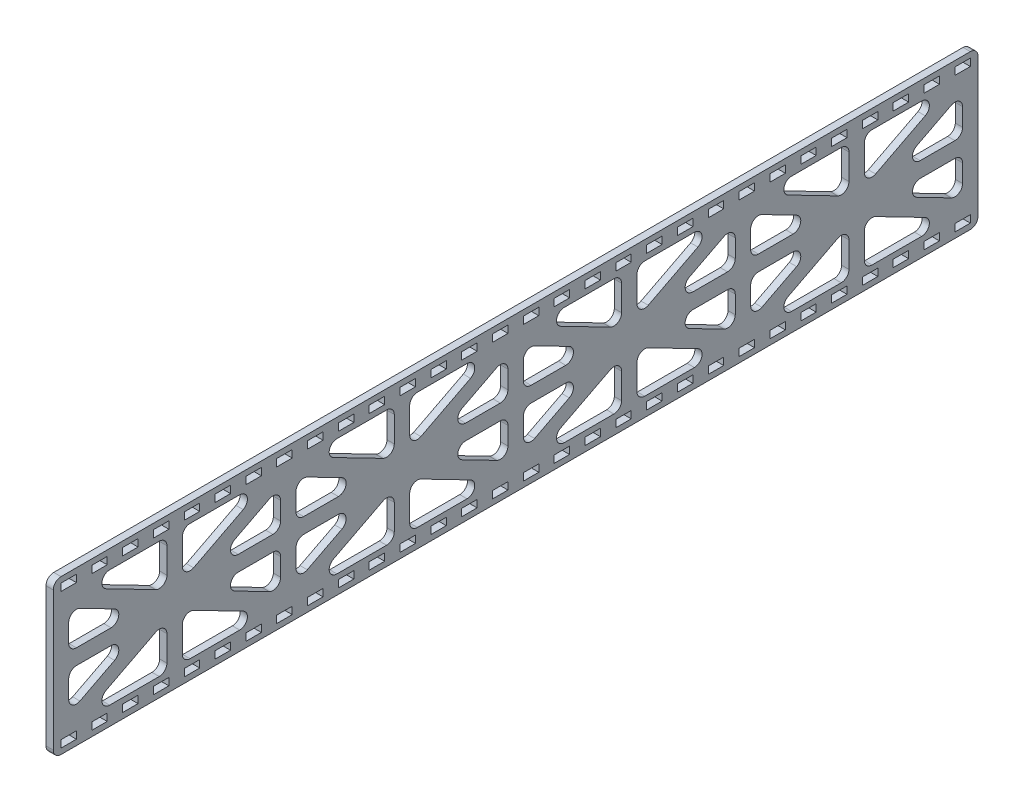
from build123d import *

# Parameters (mm, degrees)
SKETCH1_W          = 381
SKETCH1_H          = 63.5
OUTER_CUT_DEPTH    = 1.4986
CUT_EXTRUDE1_DEPTH = 194.150966106
FILLET1_R          = 3.175
SKETCH2_W          = 6.35
SKETCH2_H          = 3
SLOT_DEPTH         = 194.150966106
SLOTS_COUNT        = 16
SLOTS_PITCH        = 12.7
SLOTS_COUNT_DIR2   = 16
SLOTS_PITCH_DIR2   = 12.7


# Read off the part's stored shape, not the designer's step: Mirror1
with BuildPart() as part:
    # Sketch1 → Outer Cut (new, symmetric)
    with BuildSketch(Plane(origin=(0, 0, 0), x_dir=(0, 0, -1), z_dir=(1, 0, 0))):
        Rectangle(SKETCH1_W, SKETCH1_H)
    extrude(amount=OUTER_CUT_DEPTH, both=True)

    # Sketch3 → Cut-Extrude1 (cut, through all)
    with BuildSketch(Plane(origin=(1.4986, 0, 0), x_dir=(0, 0, -1), z_dir=(1, 0, 0))):
        Polygon((-184.15, 18.922387635), (-184.15, 3.175), (-153.587635839, 3.175), align=None)
        Polygon((-153.587635839, -3.175), (-184.15, -3.175), (-184.15, -18.922387635), align=None)
        Polygon((-143.66875, -5.207612365), (-180.39312074, -24.13), (-143.66875, -24.13), align=None)
        Polygon((-143.66875, 24.13), (-180.39312074, 24.13), (-143.66875, 5.207612365), align=None)
        Polygon((-100.59437926, 24.13), (-137.31875, 24.13), (-137.31875, 5.207612365), align=None)
        Polygon((-96.8375, 18.922387635), (-127.399864161, 3.175), (-96.8375, 3.175), align=None)
        Polygon((-127.399864161, -3.175), (-96.8375, -18.922387635), (-96.8375, -3.175), align=None)
        Polygon((-137.31875, -5.207612365), (-137.31875, -24.13), (-100.59437926, -24.13), align=None)
        Polygon((-50.00625, -5.207612365), (-86.73062074, -24.13), (-50.00625, -24.13), align=None)
        Polygon((-90.4875, -3.175), (-90.4875, -18.922387635), (-59.925135839, -3.175), align=None)
        Polygon((-90.4875, 18.922387635), (-90.4875, 3.175), (-59.925135839, 3.175), align=None)
        Polygon((-50.00625, 24.13), (-86.73062074, 24.13), (-50.00625, 5.207612365), align=None)
        Polygon((-6.93187926, 24.13), (-43.65625, 24.13), (-43.65625, 5.207612365), align=None)
        Polygon((-3.175, 18.922387635), (-33.737364161, 3.175), (-3.175, 3.175), align=None)
        Polygon((-33.737364161, -3.175), (-3.175, -18.922387635), (-3.175, -3.175), align=None)
        Polygon((-43.65625, -5.207612365), (-43.65625, -24.13), (-6.93187926, -24.13), align=None)
        Polygon((6.93187926, -24.13), (43.65625, -24.13), (43.65625, -5.207612365), align=None)
        Polygon((3.175, -3.175), (3.175, -18.922387635), (33.737364161, -3.175), align=None)
        Polygon((3.175, 18.922387635), (3.175, 3.175), (33.737364161, 3.175), align=None)
        Polygon((43.65625, 5.207612365), (43.65625, 24.13), (6.93187926, 24.13), align=None)
        Polygon((100.59437926, -24.13), (137.31875, -24.13), (137.31875, -5.207612365), align=None)
        Polygon((96.8375, -3.175), (96.8375, -18.922387635), (127.399864161, -3.175), align=None)
        Polygon((96.8375, 3.175), (127.399864161, 3.175), (96.8375, 18.922387635), align=None)
        Polygon((137.31875, 5.207612365), (137.31875, 24.13), (100.59437926, 24.13), align=None)
        Polygon((143.66875, 5.207612365), (180.39312074, 24.13), (143.66875, 24.13), align=None)
        Polygon((153.587635839, 3.175), (184.15, 3.175), (184.15, 18.922387635), align=None)
        Polygon((153.587635839, -3.175), (184.15, -18.922387635), (184.15, -3.175), align=None)
        Polygon((143.66875, -24.13), (180.39312074, -24.13), (143.66875, -5.207612365), align=None)
        Polygon((50.00625, -24.13), (86.73062074, -24.13), (50.00625, -5.207612365), align=None)
        Polygon((59.925135839, -3.175), (90.4875, -18.922387635), (90.4875, -3.175), align=None)
        Polygon((59.925135839, 3.175), (90.4875, 3.175), (90.4875, 18.922387635), align=None)
        Polygon((50.00625, 5.207612365), (86.73062074, 24.13), (50.00625, 24.13), align=None)
    extrude(amount=-CUT_EXTRUDE1_DEPTH, mode=Mode.SUBTRACT)

    # Fillet1
    fillet1_edges = [part.edges().sort_by_distance(p)[0] for p in [
        (0, 5.207612365, 43.65625),
        (0, 24.13, 43.65625),
        (0, 24.13, 6.93187926),
        (0, 24.13, 86.73062074),
        (0, 24.13, 50.00625),
        (0, 5.207612365, 50.00625),
        (0, 3.175, 90.4875),
        (0, 18.922387635, 90.4875),
        (0, 3.175, 59.925135839),
        (0, -18.922387635, 90.4875),
        (0, -3.175, 90.4875),
        (0, -3.175, 59.925135839),
        (0, -5.207612365, -43.65625),
        (0, -24.13, -43.65625),
        (0, -24.13, -6.93187926),
        (0, -5.207612365, 43.65625),
        (0, -24.13, 6.93187926),
        (0, -24.13, 43.65625),
        (0, -3.175, 33.737364161),
        (0, -3.175, 3.175),
        (0, -18.922387635, 3.175),
        (0, 3.175, 33.737364161),
        (0, 18.922387635, 3.175),
        (0, 3.175, 3.175),
        (0, -24.13, 180.39312074),
        (0, -5.207612365, 143.66875),
        (0, -24.13, 143.66875),
        (0, -18.922387635, 184.15),
        (0, -3.175, 184.15),
        (0, -3.175, 153.587635839),
        (0, 24.13, 180.39312074),
        (0, 24.13, 143.66875),
        (0, 5.207612365, 143.66875),
        (0, 5.207612365, 137.31875),
        (0, 24.13, 137.31875),
        (0, 24.13, 100.59437926),
        (0, -5.207612365, 50.00625),
        (0, -24.13, 50.00625),
        (0, -24.13, 86.73062074),
        (0, -5.207612365, 137.31875),
        (0, -24.13, 100.59437926),
        (0, -24.13, 137.31875),
        (0, -18.922387635, 96.8375),
        (0, -3.175, 127.399864161),
        (0, -3.175, 96.8375),
        (0, 3.175, 96.8375),
        (0, 3.175, 127.399864161),
        (0, 18.922387635, 96.8375),
        (0, -5.207612365, -50.00625),
        (0, -24.13, -86.73062074),
        (0, -24.13, -50.00625),
        (0, -5.207612365, -143.66875),
        (0, -24.13, -180.39312074),
        (0, -24.13, -143.66875),
        (0, -3.175, -153.587635839),
        (0, -3.175, -184.15),
        (0, -18.922387635, -184.15),
        (0, 3.175, -153.587635839),
        (0, 18.922387635, -184.15),
        (0, 3.175, -184.15),
        (0, 5.207612365, -50.00625),
        (0, 24.13, -50.00625),
        (0, 24.13, -86.73062074),
        (0, 3.175, -59.925135839),
        (0, 18.922387635, -90.4875),
        (0, 3.175, -90.4875),
        (0, -3.175, -59.925135839),
        (0, -3.175, -90.4875),
        (0, -18.922387635, -90.4875),
        (0, -5.207612365, -137.31875),
        (0, -24.13, -137.31875),
        (0, -24.13, -100.59437926),
        (0, 24.13, -6.93187926),
        (0, 24.13, -43.65625),
        (0, 5.207612365, -43.65625),
        (0, 18.922387635, -3.175),
        (0, 3.175, -33.737364161),
        (0, 3.175, -3.175),
        (0, -18.922387635, -3.175),
        (0, -3.175, -3.175),
        (0, -3.175, -33.737364161),
        (0, 24.13, -143.66875),
        (0, 24.13, -180.39312074),
        (0, 5.207612365, -143.66875),
        (0, 24.13, -100.59437926),
        (0, 24.13, -137.31875),
        (0, 5.207612365, -137.31875),
        (0, 18.922387635, -96.8375),
        (0, 3.175, -127.399864161),
        (0, 3.175, -96.8375),
        (0, -18.922387635, -96.8375),
        (0, -3.175, -96.8375),
        (0, -3.175, -127.399864161),
        (0, 3.175, 184.15),
        (0, 18.922387635, 184.15),
        (0, 3.175, 153.587635839),
        (0, 31.75, 190.5),
        (0, 31.75, -190.5),
        (0, -31.75, -190.5),
        (0, -31.75, 190.5),
    ]]
    fillet(fillet1_edges, radius=FILLET1_R)

    # Sketch2 → Slot (cut, through all)
    with BuildSketch(Plane(origin=(1.4986, 0, 0), x_dir=(0, 0, -1), z_dir=(1, 0, 0))):
        with Locations((6.35, 27.94)):
            Rectangle(SKETCH2_W, SKETCH2_H)
    slot = extrude(amount=-SLOT_DEPTH, mode=Mode.SUBTRACT)

    # Slots: Slot 16 × 16
    with Locations(*[Vector(0, 0, 1) * (i * SLOTS_PITCH) + Vector(0, 0, -1) * (j * SLOTS_PITCH_DIR2) for i in range(SLOTS_COUNT) for j in range(SLOTS_COUNT_DIR2) if (i, j) != (0, 0)]):
        add(slot, mode=Mode.SUBTRACT)

    # Mirror1
    split(bisect_by=Plane.ZX, keep=Keep.TOP)

    # Mirror1 2: part across plane


with BuildPart() as part_1:
    add(part.part)
    add(part.part.mirror(Plane.ZX))


solid = part_1.part
